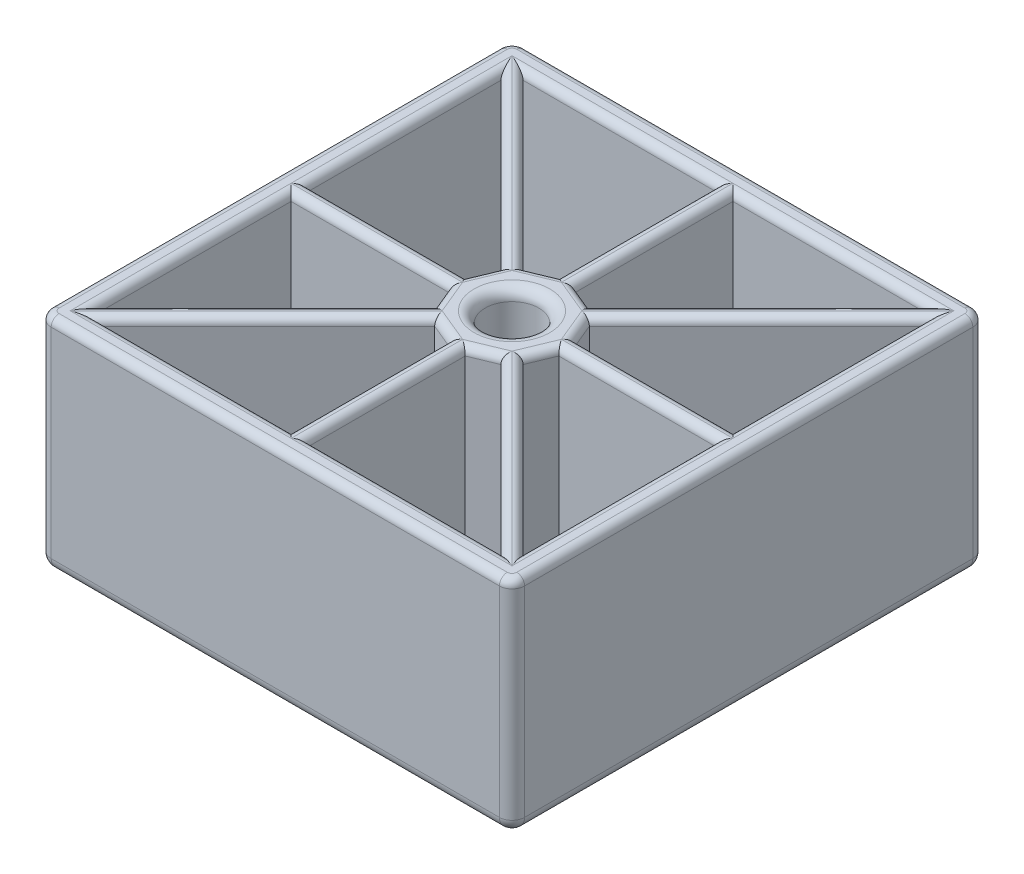
from build123d import *

# Parameters (mm, degrees)
SKETCH1_W           = 30
SKETCH1_H           = 30
BOSS_EXTRUDE1_DEPTH = 14
SKETCH2_R           = 1.7
CUT_EXTRUDE1_DEPTH  = 12
CUT_EXTRUDE2_DEPTH  = 11
FILLET1_R           = 0.7
FILLET2_R           = 0.5
FILLET3_R           = 0.8
FILLET4_R           = 0.8


# Some blends are built 0.0001 mm under size
with BuildPart() as part:
    # Sketch1 → Boss-Extrude1 (new body)
    with BuildSketch(Plane(origin=(0, 0, 0), x_dir=(1, 0, 0), z_dir=(0, 1, 0))):
        Rectangle(SKETCH1_W, SKETCH1_H)
    extrude(amount=BOSS_EXTRUDE1_DEPTH)

    # Sketch2 → Cut-Extrude1 (cut)
    with BuildSketch(Plane(origin=(0, 14, 0), x_dir=(1, 0, 0), z_dir=(0, 1, 0))):
        with Locations(Location((0, 0, 0), (0, 0, 270))):
            Circle(SKETCH2_R)
    extrude(amount=-CUT_EXTRUDE1_DEPTH, mode=Mode.SUBTRACT)

    # Sketch3 → Cut-Extrude2 (cut)
    with BuildSketch(Plane(origin=(0, 14, 0), x_dir=(1, 0, 0), z_dir=(0, 1, 0))):
        Polygon((2.095936352, 2.803043133), (12.792893219, 13.5), (0.5, 13.5), (0.5, 3.464101615), align=None)
        Polygon((2.803043133, 2.095936352), (13.5, 12.792893219), (13.5, 0.5), (3.464101615, 0.5), align=None)
        Polygon((3.464101615, -0.5), (13.5, -0.5), (13.5, -12.792893219), (2.803043133, -2.095936352), align=None)
        Polygon((2.095936352, -2.803043133), (12.792893219, -13.5), (0.5, -13.5), (0.5, -3.464101615), align=None)
        Polygon((-2.095936352, -2.803043133), (-12.792893219, -13.5), (-0.5, -13.5), (-0.5, -3.464101615), align=None)
        Polygon((-2.803043133, -2.095936352), (-13.5, -12.792893219), (-13.5, -0.5), (-3.464101615, -0.5), align=None)
        Polygon((-2.803043133, 2.095936352), (-13.5, 12.792893219), (-13.5, 0.5), (-3.464101615, 0.5), align=None)
        Polygon((-2.095936352, 2.803043133), (-12.792893219, 13.5), (-0.5, 13.5), (-0.5, 3.464101615), align=None)
    extrude(amount=-CUT_EXTRUDE2_DEPTH, mode=Mode.SUBTRACT)

    # Fillet1
    fillet1_edges = [part.edges().sort_by_distance(p)[0] for p in [
        (0, 14, -1.7),
    ]]
    fillet(fillet1_edges, radius=FILLET1_R)

    # Fillet2
    fillet2_edges = [part.edges().sort_by_distance(p)[0] for p in [
        (0, 14, 15),
        (15, 14, 0),
        (8.482050808, 14, -0.5),
        (13.5, 14, -6.646446609),
        (8.151521567, 14, -7.444414786),
        (3.133572374, 14, -1.297968176),
        (-0.5, 14, 8.482050808),
        (-1.297968176, 14, 3.133572374),
        (-7.444414785, 14, 8.151521567),
        (-6.646446609, 14, 13.5),
        (0.5, 14, -8.482050808),
        (1.297968176, 14, -3.133572374),
        (7.444414786, 14, -8.151521567),
        (6.646446609, 14, -13.5),
        (0, 14, -15),
        (0.5, 14, 8.482050808),
        (6.646446609, 14, 13.5),
        (7.444414786, 14, 8.151521567),
        (1.297968176, 14, 3.133572374),
        (-8.482050808, 14, 0.5),
        (-13.5, 14, 6.646446609),
        (-8.151521567, 14, 7.444414786),
        (-3.133572374, 14, 1.297968176),
        (-8.482050808, 14, -0.5),
        (-3.133572374, 14, -1.297968176),
        (-8.151521567, 14, -7.444414786),
        (-13.5, 14, -6.646446609),
        (13.5, 14, 6.646446609),
        (8.482050808, 14, 0.5),
        (3.133572374, 14, 1.297968176),
        (8.151521567, 14, 7.444414786),
        (-0.5, 14, -8.482050808),
        (-6.646446609, 14, -13.5),
        (-7.444414786, 14, -8.151521567),
        (-1.297968176, 14, -3.133572374),
        (-15, 14, 0),
    ]]
    fillet(fillet2_edges, radius=FILLET2_R - 0.0001)  # a hair under: the kernel refuses the full size

    # Fillet3
    fillet3_edges = [part.edges().sort_by_distance(p)[0] for p in [
        (15, 0, 0),
        (0, 0, 15),
        (-15, 0, 0),
        (0, 0, -15),
    ]]
    fillet(fillet3_edges, radius=FILLET3_R)

    # Fillet4
    # the kernel refuses this fillet: 0.8 mm, written as the material it takes off along each edge
    with BuildSketch(Plane(origin=(-14.2, 14, 14.2), x_dir=(-1, 0, 0), z_dir=(0, 0, -1))) as fillet4_piece_1:
        with BuildLine():
            CenterArc((0.3001, -0.4999), 0.4999, 0, 90)
            Line((0.8, -0.4999), (0.8, 0))
            Line((0.8, 0), (0.3001, 0))
        make_face()
    revolve(axis=Axis((-14.2, 14, 14.2), (0, 1, 0)), revolution_arc=90, mode=Mode.SUBTRACT)
    with BuildSketch(Plane(origin=(-14.2, 14, -14.2), x_dir=(0, 0, -1), z_dir=(1, 0, 0))) as fillet4_piece_2:
        with BuildLine():
            CenterArc((0.3001, -0.4999), 0.4999, 0, 90)
            Line((0.8, -0.4999), (0.8, 0))
            Line((0.8, 0), (0.3001, 0))
        make_face()
    revolve(axis=Axis((-14.2, 14, -14.2), (0, 1, 0)), revolution_arc=90, mode=Mode.SUBTRACT)
    with BuildSketch(Plane(origin=(14.2, 14, 14.2), x_dir=(0, 0, 1), z_dir=(-1, 0, 0))) as fillet4_piece_3:
        with BuildLine():
            CenterArc((0.3001, -0.4999), 0.4999, 0, 90)
            Line((0.8, -0.4999), (0.8, 0))
            Line((0.8, 0), (0.3001, 0))
        make_face()
    revolve(axis=Axis((14.2, 14, 14.2), (0, 1, 0)), revolution_arc=90, mode=Mode.SUBTRACT)
    with BuildSketch(Plane(origin=(14.2, 14, -14.2), x_dir=(1, 0, 0), z_dir=(0, 0, 1))) as fillet4_piece_4:
        with BuildLine():
            CenterArc((0.3001, -0.4999), 0.4999, 0, 90)
            Line((0.8, -0.4999), (0.8, 0))
            Line((0.8, 0), (0.3001, 0))
        make_face()
    revolve(axis=Axis((14.2, 14, -14.2), (0, 1, 0)), revolution_arc=90, mode=Mode.SUBTRACT)
    with BuildSketch(Plane(origin=(14.2, 0.8, 14.2), x_dir=(1, 0, 0), z_dir=(0, 0, 1))) as fillet4_piece_5_section:
        Polygon((0, 0), (FILLET4_R, 0), (FILLET4_R, -FILLET4_R), (0, -FILLET4_R), align=None)
    fillet4_piece_5 = extrude(amount=FILLET4_R, mode=Mode.PRIVATE)
    fillet4_piece_5 = fillet4_piece_5 - Plane(origin=(14.2, 0.8, 14.2), x_dir=(-0.7071067811865475, 0.7071067811865475, 0), z_dir=(0, 0, 1)) * Sphere(FILLET4_R, mode=Mode.PRIVATE)
    add(fillet4_piece_5, mode=Mode.SUBTRACT)
    with BuildSketch(Plane(origin=(14.2, 0.8, -14.2), x_dir=(0, 0, -1), z_dir=(1, 0, 0))) as fillet4_piece_6_section:
        Polygon((0, 0), (FILLET4_R, 0), (FILLET4_R, -FILLET4_R), (0, -FILLET4_R), align=None)
    fillet4_piece_6 = extrude(amount=FILLET4_R, mode=Mode.PRIVATE)
    fillet4_piece_6 = fillet4_piece_6 - Plane(origin=(14.2, 0.8, -14.2), x_dir=(0, 0.7071067811865475, 0.7071067811865475), z_dir=(1, 0, 0)) * Sphere(FILLET4_R, mode=Mode.PRIVATE)
    add(fillet4_piece_6, mode=Mode.SUBTRACT)
    with BuildSketch(Plane(origin=(-14.2, 0.8, 14.2), x_dir=(-1, 0, 0), z_dir=(0, 0, 1))) as fillet4_piece_7_section:
        Polygon((0, 0), (FILLET4_R, 0), (FILLET4_R, FILLET4_R), (0, FILLET4_R), align=None)
    fillet4_piece_7 = extrude(amount=FILLET4_R, mode=Mode.PRIVATE)
    fillet4_piece_7 = fillet4_piece_7 - Plane(origin=(-14.2, 0.8, 14.2), x_dir=(0.7071067811865475, 0.7071067811865475, 0), z_dir=(0, 0, 1)) * Sphere(FILLET4_R, mode=Mode.PRIVATE)
    add(fillet4_piece_7, mode=Mode.SUBTRACT)
    with BuildSketch(Plane(origin=(-14.2, 0.8, -14.2), x_dir=(0, 0, -1), z_dir=(-1, 0, 0))) as fillet4_piece_8_section:
        Polygon((0, 0), (FILLET4_R, 0), (FILLET4_R, FILLET4_R), (0, FILLET4_R), align=None)
    fillet4_piece_8 = extrude(amount=FILLET4_R, mode=Mode.PRIVATE)
    fillet4_piece_8 = fillet4_piece_8 - Plane(origin=(-14.2, 0.8, -14.2), x_dir=(0, 0.7071067811865475, 0.7071067811865475), z_dir=(-1, 0, 0)) * Sphere(FILLET4_R, mode=Mode.PRIVATE)
    add(fillet4_piece_8, mode=Mode.SUBTRACT)
    with BuildSketch(Plane(origin=(15, 0.8, -15), x_dir=(0, 0, 1), z_dir=(0, 1, 0)), Plane(origin=(15, 0.8, 15), x_dir=(-1, 0, 0), z_dir=(0, 1, 0))) as fillet4_piece_9:
        with BuildLine():
            CenterArc((FILLET4_R, -FILLET4_R), FILLET4_R, 90, 90)
            Line((0, -FILLET4_R), (0, 0))
            Line((0, 0), (FILLET4_R, 0))
        make_face()
    extrude(amount=13.2, mode=Mode.SUBTRACT)
    with BuildSketch(Plane(origin=(-15, 0.8, 15), x_dir=(1, 0, 0), z_dir=(0, 1, 0)), Plane(origin=(-15, 0.8, -15), x_dir=(0, 0, 1), z_dir=(0, 1, 0))) as fillet4_piece_10:
        with BuildLine():
            CenterArc((FILLET4_R, FILLET4_R), FILLET4_R, 180, 90)
            Line((0, FILLET4_R), (0, 0))
            Line((0, 0), (FILLET4_R, 0))
        make_face()
    extrude(amount=13.2, mode=Mode.SUBTRACT)


solid = part.part
